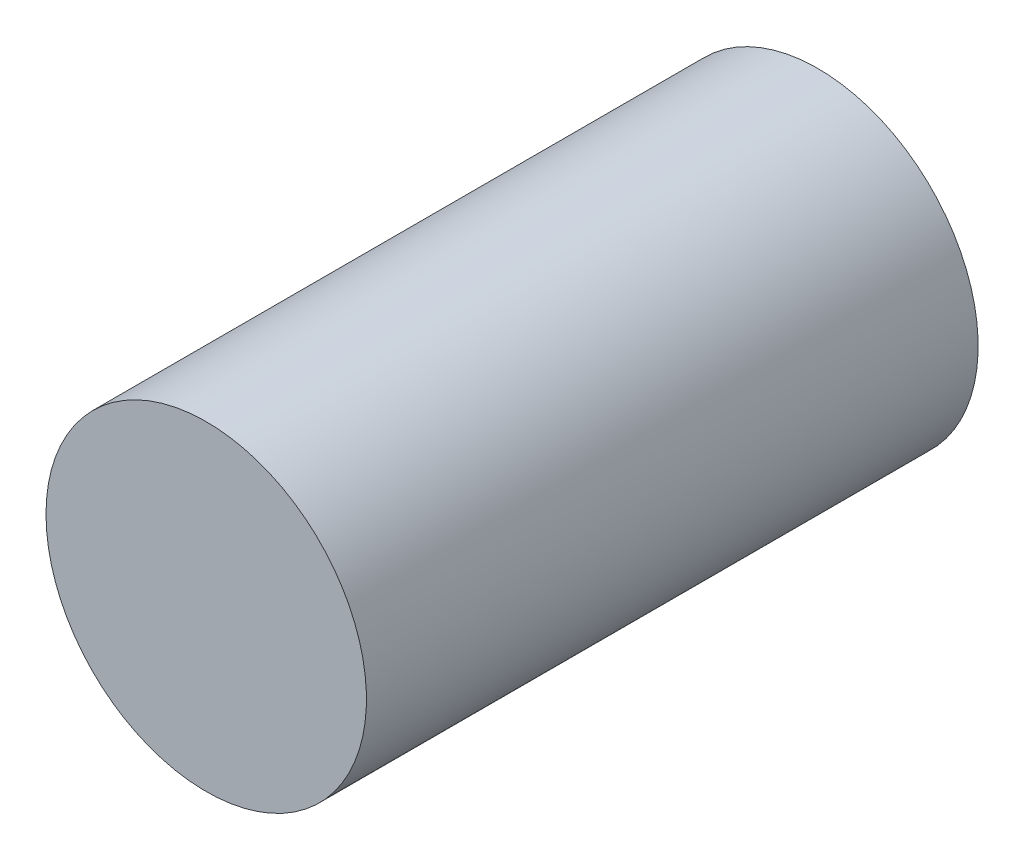
from build123d import *

# Parameters (mm, degrees)
SKETCH1_R      = 5.5
ENVELOPE_DEPTH = 21


with BuildPart() as part:
    # Sketch1 → Envelope (new body)
    with BuildSketch(Plane.XY):
        Circle(SKETCH1_R)
    extrude(amount=ENVELOPE_DEPTH)


solid = part.part
